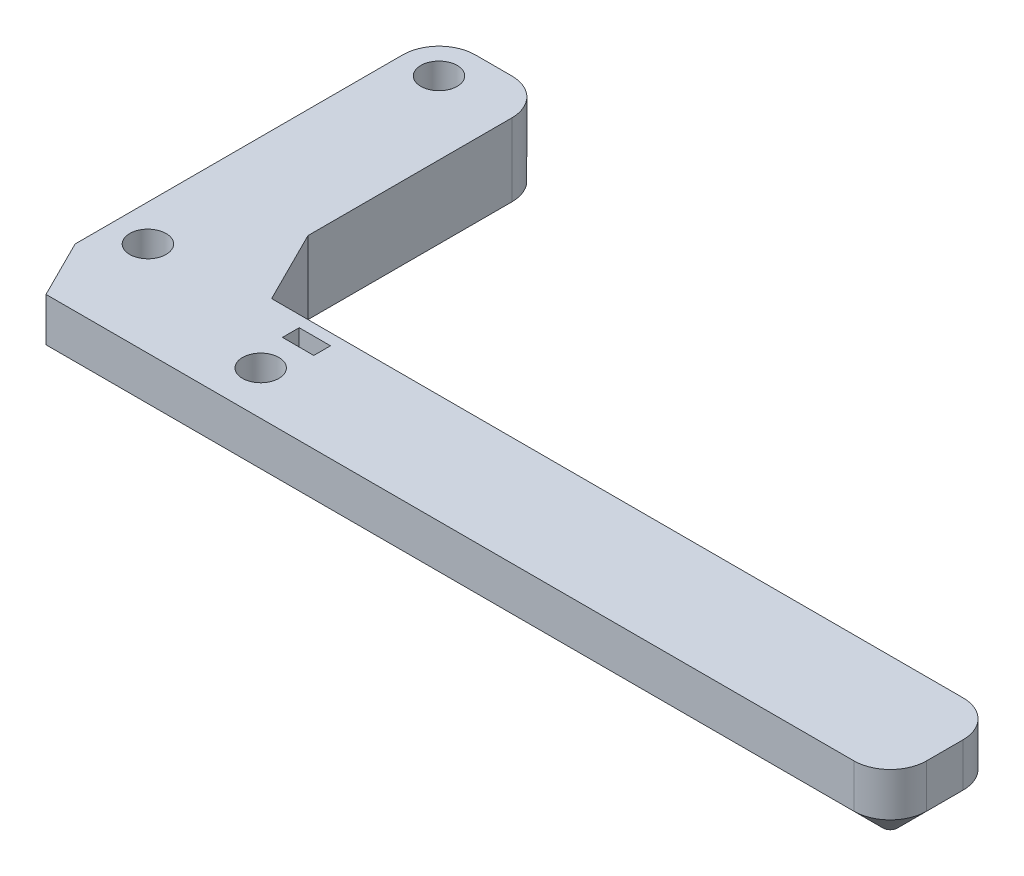
from build123d import *

# Parameters (mm, degrees)
SKETCH1_R           = 2.5
SKETCH1_W           = 4.3
SKETCH1_H           = 2.3
BOSS_EXTRUDE1_DEPTH = 10
SKETCH2_W           = 4
SKETCH2_H           = 59.39567842
CUT_EXTRUDE1_DEPTH  = 3
FILLET3_R           = 5
CHAMFER2_SIZE       = 4
SKETCH3_R           = 2.5
CUT_EXTRUDE2_DEPTH  = 10


with BuildPart() as part:
    # Sketch1 → Boss-Extrude1 (new body)
    with BuildSketch(Plane(origin=(0, 0, 0), x_dir=(1, 0, 0), z_dir=(0, 1, 0))):
        Polygon((0, -25), (0, 25), (15, 25), (15, -8), (20, -18), (32, -18), (35, -18), (120, -18), (120, -33), (4, -33), align=None)
        with Locations(Location((5, 20, 0), (0, 0, 270))):
            Circle(SKETCH1_R, mode=Mode.SUBTRACT)
        with Locations(Location((5, -20, 0), (0, 0, 270))):
            Circle(SKETCH1_R, mode=Mode.SUBTRACT)
        with Locations((27.51, -20.72)):
            Rectangle(SKETCH1_W, SKETCH1_H, mode=Mode.SUBTRACT)
    extrude(amount=BOSS_EXTRUDE1_DEPTH)

    # Sketch2 → Cut-Extrude1 (cut)
    with BuildSketch(Plane.XZ):
        with Locations((12, 4.69783921)):
            Rectangle(SKETCH2_W, SKETCH2_H)
    extrude(amount=-CUT_EXTRUDE1_DEPTH, mode=Mode.SUBTRACT)

    # Fillet3
    fillet3_edges = [part.edges().sort_by_distance(p)[0] for p in [
        (120, 5, 33),
        (120, 5, 18),
        (0, 5, -25),
        (15, 5, -25),
    ]]
    fillet(fillet3_edges, radius=FILLET3_R)

    # Chamfer2
    # the kernel refuses this chamfer: 4 mm, written as the material it takes off along each edge
    with BuildSketch(Plane(origin=(20.286731952, 0, 33), x_dir=(0, -0.027495876610586365, -0.9996219169112968), z_dir=(-1, 0, 0))) as chamfer2_piece_1:
        Polygon((CHAMFER2_SIZE * 0.999621916911, -CHAMFER2_SIZE * 0.0274958766106), (-CHAMFER2_SIZE * 0.0274958766106, -CHAMFER2_SIZE * 0.999621916911), (0, 0), align=None)
    extrude(amount=26.573463904, mode=Mode.SUBTRACT)
    with BuildSketch(Plane(origin=(115, 0, 33), x_dir=(0, 0.9996219169112968, 0.02749587661058563), z_dir=(-1, 0, 0))) as chamfer2_piece_2:
        Polygon((CHAMFER2_SIZE * 0.999621916911, CHAMFER2_SIZE * 0.0274958766106), (-CHAMFER2_SIZE * 0.0274958766106, CHAMFER2_SIZE * 0.999621916911), (0, 0), align=None)
    extrude(amount=111.286731952, mode=Mode.SUBTRACT)
    with BuildSketch(Plane(origin=(120, 0, 23), x_dir=(0.02749587661058563, 0.9996219169112968, 0), z_dir=(0, 0, 1))) as chamfer2_piece_3:
        Polygon((CHAMFER2_SIZE * 0.999621916911, CHAMFER2_SIZE * 0.0274958766106), (-CHAMFER2_SIZE * 0.0274958766106, CHAMFER2_SIZE * 0.999621916911), (0, 0), align=None)
    extrude(amount=5, mode=Mode.SUBTRACT)
    with BuildSketch(Plane(origin=(115, 0, 18), x_dir=(0, 0.999621916911297, -0.02749587661058045), z_dir=(-1, 0, 0))) as chamfer2_piece_4_section:
        Polygon((CHAMFER2_SIZE * 0.999621916911, -CHAMFER2_SIZE * 0.0274958766106), (-CHAMFER2_SIZE * 0.0274958766106, -CHAMFER2_SIZE * 0.999621916911), (0, 0), align=None)
    chamfer2_piece_4 = extrude(amount=105.286731952, mode=Mode.PRIVATE)
    chamfer2_piece_4 = split(chamfer2_piece_4, bisect_by=Plane(origin=(30.091205291, 1.322053336, 38.182410583), z_dir=(0.8944271909999159, 0, -0.4472135954999581)), keep=Keep.TOP, mode=Mode.PRIVATE)
    add(chamfer2_piece_4, mode=Mode.SUBTRACT)
    with BuildSketch(Plane(origin=(115, 0, 23), x_dir=(0, 0, -1), z_dir=(-1, 0, 0))) as chamfer2_piece_5:
        Polygon((5, -CHAMFER2_SIZE), (5 - CHAMFER2_SIZE, 0), (5, 0), align=None)
    revolve(axis=Axis((115, 0, 23), (0, -1, 0)), revolution_arc=90, mode=Mode.SUBTRACT)
    with BuildSketch(Plane(origin=(115, 0, 28), x_dir=(0, 0, 1), z_dir=(-1, 0, 0))) as chamfer2_piece_6:
        Polygon((5, CHAMFER2_SIZE), (5 - CHAMFER2_SIZE, 0), (5, 0), align=None)
    revolve(axis=Axis((115, 0, 28), (0, 1, 0)), revolution_arc=90, mode=Mode.SUBTRACT)

    # Sketch3 → Cut-Extrude2 (cut)
    with BuildSketch(Plane.XZ):
        with Locations(Location((27.5, 27, 0), (0, 0, 270))):
            Circle(SKETCH3_R)
    extrude(amount=-CUT_EXTRUDE2_DEPTH, mode=Mode.SUBTRACT)


solid = part.part
